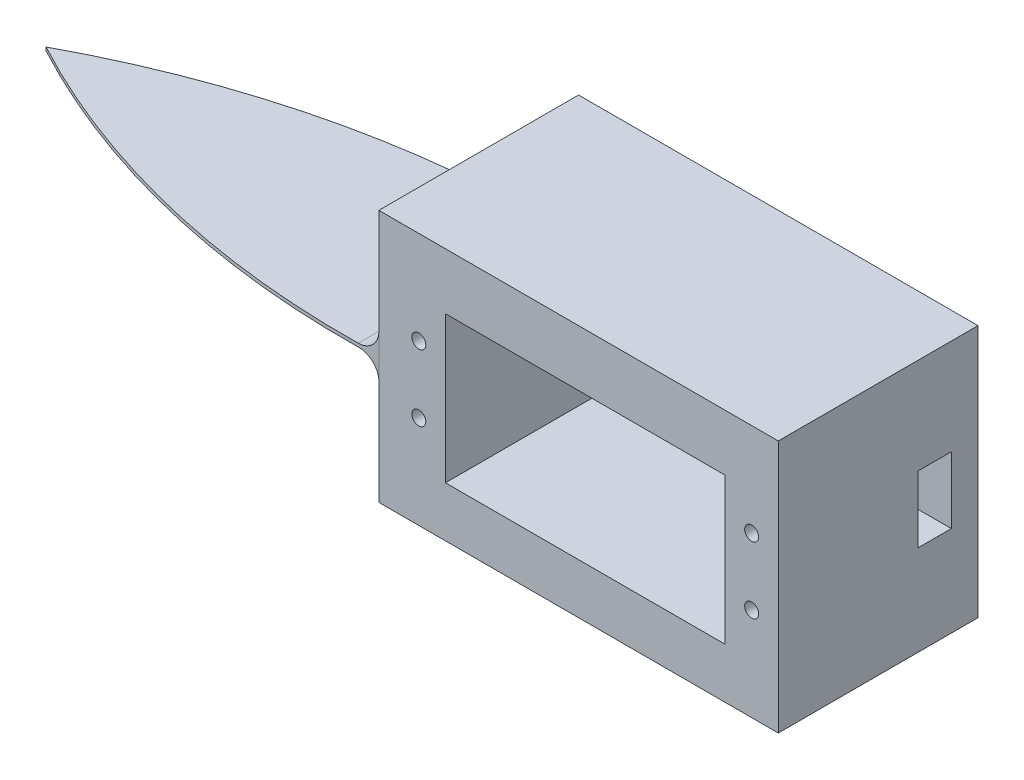
from build123d import *

# Parameters (mm, degrees)
BOSS_EXTRUDE1_DEPTH  = 4
CUT_EXTRUDE1_DEPTH   = 3
SKETCH5_W            = 49
SKETCH5_H            = 16
BOSS_EXTRUDE2_DEPTH  = 4
BOSS_EXTRUDE15_DEPTH = 30
SKETCH20_R           = 2.4
CUT_EXTRUDE26_DEPTH  = 1
FILLET8_R            = 4
FILLET12_R           = 4
CUT_EXTRUDE_8_DEPTH  = 28
SKETCH_6_R           = 1.05
CUT_EXTRUDE_9_DEPTH  = 20
SKETCH_8_W           = 6
SKETCH_8_H           = 10
CUT_EXTRUDE_10_DEPTH = 8
BOSS_EXTRUDE14_DEPTH = 4
CUT_EXTRUDE27_DEPTH  = 19
BOSS_EXTRUDE16_DEPTH = 19.25
CUT_EXTRUDE28_DEPTH  = 18.75
FILLET13_R           = 3
FILLET14_R           = 3


with BuildPart() as part:
    # Sketch2 → Boss-Extrude1 (new body)
    with BuildSketch(Plane.XY):
        with BuildLine():
            Line((23.733047461, 11.63962887), (23.733047461, -4.36037113))
            Line((23.733047461, -4.36037113), (-21.266952539, -4.36037113))
            ThreePointArc((-21.266952539, -4.36037113), (-27.597931628, 3.63962887), (-21.266952539, 11.63962887))
            Line((-21.266952539, 11.63962887), (23.733047461, 11.63962887))
        make_face()
    extrude(amount=BOSS_EXTRUDE1_DEPTH)

    # Sketch1 → Cut-Extrude1 (cut)
    with BuildSketch(Plane.XY):
        with BuildLine():
            Line((-6.25004119, 8.63962887), (-20.04279291, 6.23962887))
            ThreePointArc((-20.04279291, 6.23962887), (-22.105421524, 3.63962887), (-20.04279291, 1.03962887))
            Line((-20.04279291, 1.03962887), (-6.25004119, -1.36037113))
            ThreePointArc((-6.25004119, -1.36037113), (-2.105421524, -2.86037113), (2.039198142, -1.36037113))
            Line((2.039198142, -1.36037113), (15.831949862, 1.03962887))
            ThreePointArc((15.831949862, 1.03962887), (17.894578476, 3.63962887), (15.831949862, 6.23962887))
            Line((15.831949862, 6.23962887), (2.039198142, 8.63962887))
            ThreePointArc((2.039198142, 8.63962887), (-2.105421524, 10.13962887), (-6.25004119, 8.63962887))
        make_face()
    extrude(amount=CUT_EXTRUDE1_DEPTH, mode=Mode.SUBTRACT)

    # Sketch5 → Boss-Extrude2 (add)
    with BuildSketch(Plane(origin=(23.733047461, 0, 0), x_dir=(0, 0, -1), z_dir=(1, 0, 0))):
        with Locations((20.5, 3.63962887)):
            Rectangle(SKETCH5_W, SKETCH5_H)
    extrude(amount=BOSS_EXTRUDE2_DEPTH)

    # Sketch6 → Boss-Extrude15 (add)
    with BuildSketch(Plane(origin=(0, 0, -45), x_dir=(-1, 0, 0), z_dir=(0, 0, -1))):
        Polygon((-30.946192459, -15.36037113), (-83.733047461, -15.36037113), (-83.733047461, 22.63962887), (-23.733047461, 22.63962887), (-23.733047461, -15.36037113), align=None)
    extrude(amount=-BOSS_EXTRUDE15_DEPTH)

    # Sketch20 → Cut-Extrude26 (cut)
    with BuildSketch(Plane(origin=(0, 0, 3), x_dir=(-1, 0, 0), z_dir=(0, 0, -1))):
        with Locations((2.105421524, 3.63962887)):
            Circle(SKETCH20_R)
    extrude(amount=-CUT_EXTRUDE26_DEPTH, mode=Mode.SUBTRACT)

    # Fillet8
    fillet8_edges = [part.edges().sort_by_distance(p)[0] for p in [
        (23.733047461, 3.63962887, 0),
    ]]
    fillet(fillet8_edges, radius=FILLET8_R)

    # Fillet12
    fillet12_edges = [part.edges().sort_by_distance(p)[0] for p in [
        (27.733047461, 3.63962887, 4),
    ]]
    fillet(fillet12_edges, radius=FILLET12_R)

    # 草圖5 → 除料-伸長8 (cut)
    with BuildSketch(Plane.XY.offset(-15)):
        Polygon((75.733047461, -7.806095257), (75.733047461, 14.193904743), (33.733047461, 14.193904743), (33.733047461, 3.193904743), (33.733047461, -7.806095257), align=None)
    extrude(amount=-CUT_EXTRUDE_8_DEPTH, mode=Mode.SUBTRACT)

    # 草圖6 → 除料-伸長9 (cut)
    with BuildSketch(Plane.XY.offset(-15)):
        with Locations((29.733047461, 8.63962887)):
            Circle(SKETCH_6_R)
        with Locations((29.733047461, -1.36037113)):
            Circle(SKETCH_6_R)
        with Locations((79.733047461, 8.63962887)):
            Circle(SKETCH_6_R)
        with Locations((79.733047461, -1.36037113)):
            Circle(SKETCH_6_R)
    extrude(amount=-CUT_EXTRUDE_9_DEPTH, mode=Mode.SUBTRACT)

    # 草圖8 → 除料-伸長10 (cut)
    with BuildSketch(Plane(origin=(83.733047461, 0, 0), x_dir=(0, 0, -1), z_dir=(1, 0, 0))):
        with Locations((39, 3.238584995)):
            Rectangle(SKETCH_8_W, SKETCH_8_H)
    extrude(amount=-CUT_EXTRUDE_10_DEPTH, mode=Mode.SUBTRACT)

    # Sketch6<2> → Boss-Extrude14 (add)
    with BuildSketch(Plane(origin=(0, 0, -45), x_dir=(-1, 0, 0), z_dir=(0, 0, -1))):
        Polygon((-30.946192459, -15.36037113), (-83.733047461, -15.36037113), (-83.733047461, 22.63962887), (-23.733047461, 22.63962887), (-23.733047461, -15.36037113), align=None)
    extrude(amount=-BOSS_EXTRUDE14_DEPTH)

    # Sketch21 → Cut-Extrude27 (cut)
    with BuildSketch(Plane.XY.offset(4)):
        Polygon((-21.266952539, 11.63962887), (23.733047461, 11.63962887), (27.733047461, 11.63962887), (27.733047461, -4.36037113), (-21.266952539, -4.36037113), (-27.597931628, -4.36037113), (-27.597931628, 3.63962887), (-27.597931628, 11.63962887), align=None)
    extrude(amount=-CUT_EXTRUDE27_DEPTH, mode=Mode.SUBTRACT)

    # Sketch26 → Boss-Extrude16 (add)
    with BuildSketch(Plane(origin=(0, 22.63962887, 0), x_dir=(1, 0, 0), z_dir=(0, 1, 0))):
        with BuildLine():
            Line((23.733047461, 45), (23.733047461, 15))
            ThreePointArc((23.733047461, 15), (-9.769414537, 18.155998007), (-41.266952539, 30))
            ThreePointArc((-41.266952539, 30), (-9.769414537, 41.844001993), (23.733047461, 45))
        make_face()
    extrude(amount=-BOSS_EXTRUDE16_DEPTH)

    # Sketch26<2> → Cut-Extrude28 (cut)
    with BuildSketch(Plane(origin=(0, 22.63962887, 0), x_dir=(1, 0, 0), z_dir=(0, 1, 0))):
        with BuildLine():
            Line((23.733047461, 45), (23.733047461, 15))
            ThreePointArc((23.733047461, 15), (-9.769414537, 18.155998007), (-41.266952539, 30))
            ThreePointArc((-41.266952539, 30), (-9.769414537, 41.844001993), (23.733047461, 45))
        make_face()
    extrude(amount=-CUT_EXTRUDE28_DEPTH, mode=Mode.SUBTRACT)

    # Fillet13
    # the kernel refuses this fillet: 3 mm, written as the material it adds along each edge
    with BuildSketch(Plane(origin=(23.733047461, 3.38962887, -52.5), x_dir=(0, -1, 0), z_dir=(0, 0, 1))) as fillet13_piece_1_section:
        with BuildLine():
            CenterArc((FILLET13_R, -FILLET13_R), FILLET13_R, 90, 90)
            Line((0, -FILLET13_R), (0, 0))
            Line((0, 0), (FILLET13_R, 0))
        make_face()
    fillet13_piece_1 = extrude(amount=37.5, mode=Mode.PRIVATE)
    fillet13_piece_1 = split(fillet13_piece_1, bisect_by=Plane(origin=(22.499991294, 3.049704753, -45), z_dir=(0, 0, -1)), keep=Keep.TOP, mode=Mode.PRIVATE)
    fillet13_piece_1 = fillet13_piece_1 & Plane(origin=(18.787742814, 3.049704753, 81.90367986), x_dir=(-0.472871616946814, 0, -0.8811313374781911), z_dir=(0, 1, 0)) * Cylinder(127, 87, mode=Mode.PRIVATE)
    add(fillet13_piece_1)
    with BuildSketch(Plane(origin=(23.733047461, 3.38962887, -45), x_dir=(0, -1, 0), z_dir=(0, 0, 1))) as fillet13_piece_2:
        with BuildLine():
            CenterArc((FILLET13_R, -FILLET13_R), FILLET13_R, 90, 90)
            Line((0, -FILLET13_R), (0, 0))
            Line((0, 0), (FILLET13_R, 0))
        make_face()
    extrude(amount=30)
    with BuildSketch(Plane(origin=(23.733047461, 3.38962887, -45), x_dir=(0, -1, 0), z_dir=(0, 0, 1))) as fillet13_piece_3_section:
        with BuildLine():
            CenterArc((FILLET13_R, -FILLET13_R), FILLET13_R, 90, 90)
            Line((0, -FILLET13_R), (0, 0))
            Line((0, 0), (FILLET13_R, 0))
        make_face()
    fillet13_piece_3 = extrude(amount=37.5, mode=Mode.PRIVATE)
    fillet13_piece_3 = split(fillet13_piece_3, bisect_by=Plane(origin=(22.499977065, 3.049704014, -15), z_dir=(0, 0, 1)), keep=Keep.TOP, mode=Mode.PRIVATE)
    fillet13_piece_3 = fillet13_piece_3 & Plane(origin=(18.787742814, 3.049704014, -141.90367986), x_dir=(0.03893940667523239, 0, 0.9992415736986632), z_dir=(0, 1, 0)) * Cylinder(127, 87, mode=Mode.PRIVATE)
    add(fillet13_piece_3)

    # Fillet14
    # the kernel refuses this fillet: 3 mm, written as the material it adds along each edge
    with BuildSketch(Plane(origin=(23.733047461, 3.88962887, -52.5), x_dir=(-1, 0, 0), z_dir=(0, 0, 1))) as fillet14_piece_1_section:
        with BuildLine():
            CenterArc((FILLET14_R, -FILLET14_R), FILLET14_R, 90, 90)
            Line((0, -FILLET14_R), (0, 0))
            Line((0, 0), (FILLET14_R, 0))
        make_face()
    fillet14_piece_1 = extrude(amount=37.5, mode=Mode.PRIVATE)
    fillet14_piece_1 = fillet14_piece_1 & Plane(origin=(18.787742814, 4.229564141, 81.90367986), x_dir=(-0.472871616947038, 0, -0.8811313374780708), z_dir=(0, 1, 0)) * Cylinder(127, 87, mode=Mode.PRIVATE)
    fillet14_piece_1 = split(fillet14_piece_1, bisect_by=Plane(origin=(22.499997124, 4.229564141, -45), z_dir=(0, 0, -1)), keep=Keep.TOP, mode=Mode.PRIVATE)
    add(fillet14_piece_1)
    with BuildSketch(Plane(origin=(23.733047461, 3.88962887, -45), x_dir=(-1, 0, 0), z_dir=(0, 0, 1))) as fillet14_piece_2:
        with BuildLine():
            CenterArc((FILLET14_R, -FILLET14_R), FILLET14_R, 90, 90)
            Line((0, -FILLET14_R), (0, 0))
            Line((0, 0), (FILLET14_R, 0))
        make_face()
    extrude(amount=30)
    with BuildSketch(Plane(origin=(23.733047461, 3.88962887, -45), x_dir=(-1, 0, 0), z_dir=(0, 0, 1))) as fillet14_piece_3_section:
        with BuildLine():
            CenterArc((FILLET14_R, -FILLET14_R), FILLET14_R, 90, 90)
            Line((0, -FILLET14_R), (0, 0))
            Line((0, 0), (FILLET14_R, 0))
        make_face()
    fillet14_piece_3 = extrude(amount=37.5, mode=Mode.PRIVATE)
    fillet14_piece_3 = fillet14_piece_3 & Plane(origin=(18.787742814, 4.229551156, -141.90367986), x_dir=(0.03893940667498725, 0, 0.9992415736986727), z_dir=(0, 1, 0)) * Cylinder(127, 87, mode=Mode.PRIVATE)
    fillet14_piece_3 = split(fillet14_piece_3, bisect_by=Plane(origin=(22.499980416, 4.229551156, -15), z_dir=(0, 0, 1)), keep=Keep.TOP, mode=Mode.PRIVATE)
    add(fillet14_piece_3)


solid = part.part
